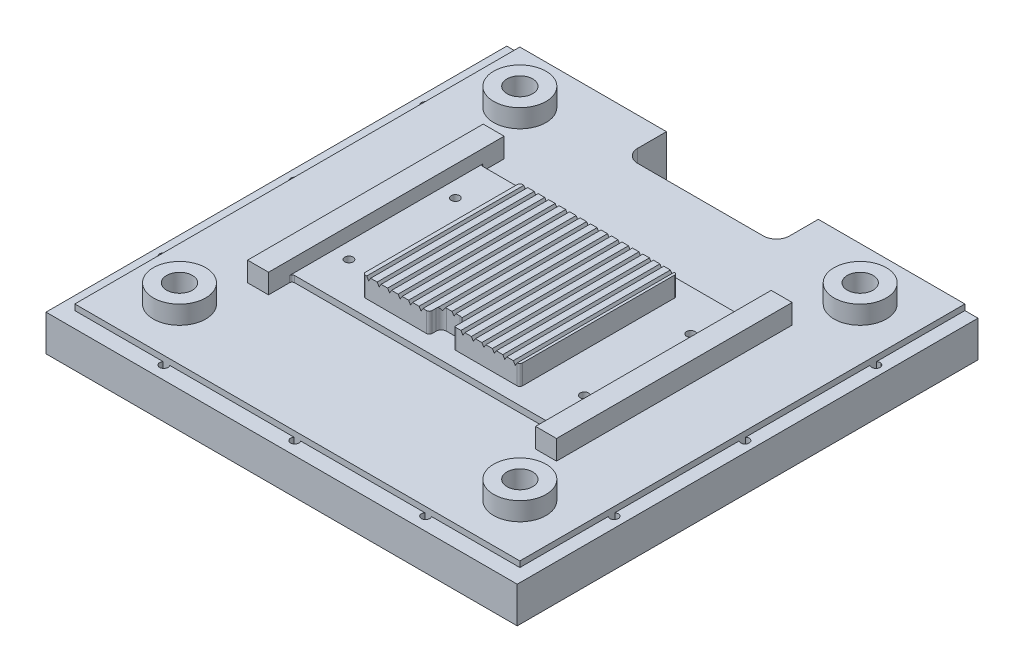
from build123d import *

# Parameters (mm, degrees)
BOSS_EXTRUDE1_OUTLINE_W              = 90
BOSS_EXTRUDE1_OUTLINE_H              = 88
BOSS_EXTRUDE1_DEPTH                  = 6.9
BOSS_EXTRUDE1_2_OUTLINE_R            = 3.969
BOSS_EXTRUDE1_2_DEPTH                = 8
BOSS_EXTRUDE1_START                  = 4.166
BOSS_EXTRUDE1_3_OUTLINE_R            = 5
BOSS_EXTRUDE1_3_OUTLINE_R_2          = 2.4575
BOSS_EXTRUDE1_3_DEPTH                = 7.334
BOSS_EXTRUDE1_START_2                = 11.5
BOSS_EXTRUDE1_4_DEPTH                = 0.88
BOSS_EXTRUDE1_START_3                = 12.38
BOSS_EXTRUDE1_5_DEPTH                = 0.62
BOSS_EXTRUDE1_START_4                = -15
BOSS_EXTRUDE1_6_DEPTH                = 30
SKETCH2_R                            = 3.969
CUT_EXTRUDE1_DEPTH                   = 4.166
SKETCH5_W                            = 51.5
SKETCH5_H                            = 8
CUT_EXTRUDE2_DEPTH                   = 10
FILLET1_R                            = 2.5
BOSS_EXTRUDE3_DEPTH                  = 2.3
SKETCH11_R                           = 2.15
CUT_EXTRUDE6_DEPTH                   = 65.36505263
SKETCH12_W                           = 4
SKETCH12_H                           = 45
BOSS_EXTRUDE4_DEPTH                  = 4.85
SKETCH16_W                           = 35
SKETCH16_H                           = 13
CUT_EXTRUDE9_DEPTH                   = 3
FILLET2_R                            = 1.5
SKETCH18_W                           = 0.8
SKETCH18_H                           = 9.2
TAP_DRILL_FOR_M2X0_4_TAP2_AT_2_COUNT = 2
TAP_DRILL_FOR_M2X0_4_TAP2_AT_2_PITCH = 20.32
MIRROR1_COPY_1_SKETCH_W              = 0.8
MIRROR1_COPY_1_SKETCH_H              = 9.2
SKETCH20_W                           = 0.8
SKETCH20_H                           = 6.9
TAP_DRILL_FOR_M2X0_4_TAP1_AT_2_COUNT = 2
TAP_DRILL_FOR_M2X0_4_TAP1_AT_2_PITCH = 25
TAP_DRILL_FOR_M2X0_4_TAP1_AT_3_COUNT = 2
TAP_DRILL_FOR_M2X0_4_TAP1_AT_3_PITCH = 50
TAP_DRILL_FOR_M2X0_4_TAP1_AT_4_COUNT = 2
TAP_DRILL_FOR_M2X0_4_TAP1_AT_4_PITCH = 70.34202158
TAP_DRILL_FOR_M2X0_4_TAP1_AT_5_COUNT = 2
TAP_DRILL_FOR_M2X0_4_TAP1_AT_5_PITCH = 80.454956342
TAP_DRILL_FOR_M2X0_4_TAP1_AT_6_COUNT = 2
TAP_DRILL_FOR_M2X0_4_TAP1_AT_6_PITCH = 96.166522241
TAP_DRILL_FOR_M2X0_4_TAP1_AT_7_COUNT = 2
TAP_DRILL_FOR_M2X0_4_TAP1_AT_7_PITCH = 99.478640924
TAP_DRILL_FOR_M2X0_4_TAP1_AT_8_COUNT = 2
TAP_DRILL_FOR_M2X0_4_TAP1_AT_8_PITCH = 89.56003573
TAP_DRILL_FOR_M2X0_4_TAP1_AT_9_COUNT = 2
TAP_DRILL_FOR_M2X0_4_TAP1_AT_9_PITCH = 86
FILLET3_R                            = 0.5


with BuildPart() as part:
    # Boss-Extrude1: read off the stored shape, not the designer's step
    # Boss-Extrude1 outline → Boss-Extrude1 (new body)
    with BuildSketch(Plane(origin=(0, 0, 0), x_dir=(1, 0, 0), z_dir=(0, 1, 0))):
        with Locations((0, -1.5)):
            Rectangle(BOSS_EXTRUDE1_OUTLINE_W, BOSS_EXTRUDE1_OUTLINE_H)
    extrude(amount=BOSS_EXTRUDE1_DEPTH)

    # Sketch2 → Cut-Extrude1 (cut)
    with BuildSketch(Plane.XZ):
        with Locations(Location((-27.5, 27.5, 0), (0, 0, 270))):
            Circle(SKETCH2_R)
        with Locations(Location((27.5, 27.5, 0), (0, 0, 90))):
            Circle(SKETCH2_R)
        with Locations(Location((27.5, -27.5, 0), (0, 0, 270))):
            Circle(SKETCH2_R)
        with Locations(Location((-27.5, -27.5, 0), (0, 0, 90))):
            Circle(SKETCH2_R)
    extrude(amount=-CUT_EXTRUDE1_DEPTH, mode=Mode.SUBTRACT)

    # Sketch5 → Cut-Extrude2 (cut)
    with BuildSketch(Plane(origin=(0, 6.9, 0), x_dir=(1, 0, 0), z_dir=(0, 1, 0))):
        with Locations((10.75, 38.5)):
            Rectangle(SKETCH5_W, SKETCH5_H)
    extrude(amount=-CUT_EXTRUDE2_DEPTH, mode=Mode.SUBTRACT)

    # Fillet1
    fillet1_edges = [part.edges().sort_by_distance(p)[0] for p in [
        (36.5, 3.45, -34.5),
        (-15, 3.45, -34.5),
    ]]
    fillet(fillet1_edges, radius=FILLET1_R)

    # Sketch4 → Boss-Extrude3 (add)
    with BuildSketch(Plane(origin=(0, 6.9, 0), x_dir=(1, 0, 0), z_dir=(0, 1, 0))):
        with BuildLine():
            Line((27, -18), (-27, -18))
            ThreePointArc((-27, -18), (-27.353553391, -17.853553391), (-27.5, -17.5))
            Line((-27.5, -17.5), (-27.5, 17.5))
            ThreePointArc((-27.5, 17.5), (-27.353553391, 17.853553391), (-27, 18))
            Line((-27, 18), (27, 18))
            ThreePointArc((27, 18), (27.353553391, 17.853553391), (27.5, 17.5))
            Line((27.5, 17.5), (27.5, -17.5))
            ThreePointArc((27.5, -17.5), (27.353553391, -17.853553391), (27, -18))
        make_face()
    extrude(amount=BOSS_EXTRUDE3_DEPTH)

    # Sketch11 → Cut-Extrude6 (cut, through all)
    with BuildSketch(Plane(origin=(0, 6.9, 0), x_dir=(1, 0, 0), z_dir=(0, 1, 0))):
        with Locations(Location((27.5, -27.5, 0), (0, 0, 270))):
            Circle(SKETCH11_R)
        with Locations(Location((-27.5, -27.5, 0), (0, 0, 270))):
            Circle(SKETCH11_R)
        with Locations(Location((-27.5, 27.5, 0), (0, 0, 270))):
            Circle(SKETCH11_R)
        with Locations(Location((27.5, 27.5, 0), (0, 0, 270))):
            Circle(SKETCH11_R)
    extrude(amount=-CUT_EXTRUDE6_DEPTH, mode=Mode.SUBTRACT)

    # Sketch12 → Boss-Extrude4 (add)
    with BuildSketch(Plane(origin=(0, 6.9, 0), x_dir=(1, 0, 0), z_dir=(0, 1, 0))):
        with Locations((27.5, 0)):
            Rectangle(SKETCH12_W, SKETCH12_H)
        with Locations((-27.5, 0)):
            Rectangle(SKETCH12_W, SKETCH12_H)
    extrude(amount=BOSS_EXTRUDE4_DEPTH)

    # Sketch16 → Cut-Extrude9 (cut)
    with BuildSketch(Plane(origin=(0, 6.9, 0), x_dir=(1, 0, 0), z_dir=(0, 1, 0))):
        with Locations((0, 24.5)):
            Rectangle(SKETCH16_W, SKETCH16_H)
        with Locations((0, -24.5)):
            Rectangle(SKETCH16_W, SKETCH16_H)
    extrude(amount=-CUT_EXTRUDE9_DEPTH, mode=Mode.SUBTRACT)

    # Fillet2
    fillet2_edges = [part.edges().sort_by_distance(p)[0] for p in [
        (17.5, 5.4, -31),
        (17.5, 5.4, -18),
        (-17.5, 5.4, -18),
        (-17.5, 5.4, -31),
        (-17.5, 5.4, 31),
        (-17.5, 5.4, 18),
        (17.5, 5.4, 18),
        (17.5, 5.4, 31),
    ]]
    fillet(fillet2_edges, radius=FILLET2_R)

    # Sketch18 → Tap Drill for M2x0.4 Tap2 (revolve, cut)
    with BuildSketch(Plane(origin=(22.48, 9.2, 10.16), x_dir=(0, 0, 1), z_dir=(1, 0, 0))):
        with Locations((0.4, 4.6)):
            Rectangle(SKETCH18_W, SKETCH18_H)
    tap_drill_for_m2x0_4_tap2 = revolve(axis=Axis((22.48, 15.55, 10.16), (0, -1, 0)), mode=Mode.SUBTRACT)

    # Tap Drill for M2x0.4 Tap2 at 2: Tap Drill for M2x0.4 Tap2 ×2
    with Locations(*[(0, 0, -i * TAP_DRILL_FOR_M2X0_4_TAP2_AT_2_PITCH) for i in range(1, TAP_DRILL_FOR_M2X0_4_TAP2_AT_2_COUNT)]):
        add(tap_drill_for_m2x0_4_tap2, mode=Mode.SUBTRACT)

    # Mirror1: Tap Drill for M2x0.4 Tap2 across plane
    add(tap_drill_for_m2x0_4_tap2.mirror(Plane(origin=(0, 0, 0), x_dir=(0, 0, 1), z_dir=(1, 0, 0))), mode=Mode.SUBTRACT)

    # Mirror1 copy 1 sketch → Mirror1 copy 1 (revolve, cut)
    with BuildSketch(Plane(origin=(-22.48, 9.2, -10.16), x_dir=(0, 0, 1), z_dir=(-1, 0, 0))):
        with Locations((0.4, -4.6)):
            Rectangle(MIRROR1_COPY_1_SKETCH_W, MIRROR1_COPY_1_SKETCH_H)
    revolve(axis=Axis((-22.48, 15.55, -10.16), (0, 1, 0)), mode=Mode.SUBTRACT)

    # Sketch20 → Tap Drill for M2x0.4 Tap1 (revolve, cut)
    with BuildSketch(Plane(origin=(-43, 6.9, -25), x_dir=(0, 0, 1), z_dir=(1, 0, 0))):
        with Locations((0.4, 3.45)):
            Rectangle(SKETCH20_W, SKETCH20_H)
    tap_drill_for_m2x0_4_tap1 = revolve(axis=Axis((-43, 13.25, -25), (0, -1, 0)), mode=Mode.SUBTRACT)

    # Tap Drill for M2x0.4 Tap1 at 2: Tap Drill for M2x0.4 Tap1 ×2
    with Locations(*[(0, 0, i * TAP_DRILL_FOR_M2X0_4_TAP1_AT_2_PITCH) for i in range(1, TAP_DRILL_FOR_M2X0_4_TAP1_AT_2_COUNT)]):
        add(tap_drill_for_m2x0_4_tap1, mode=Mode.SUBTRACT)

    # Tap Drill for M2x0.4 Tap1 at 3: Tap Drill for M2x0.4 Tap1 ×2
    with Locations(*[(0, 0, i * TAP_DRILL_FOR_M2X0_4_TAP1_AT_3_PITCH) for i in range(1, TAP_DRILL_FOR_M2X0_4_TAP1_AT_3_COUNT)]):
        add(tap_drill_for_m2x0_4_tap1, mode=Mode.SUBTRACT)

    # Tap Drill for M2x0.4 Tap1 at 4: Tap Drill for M2x0.4 Tap1 ×2
    with Locations(*[Vector(0.25589256031628077, 0, 0.9667052278615125) * (i * TAP_DRILL_FOR_M2X0_4_TAP1_AT_4_PITCH) for i in range(1, TAP_DRILL_FOR_M2X0_4_TAP1_AT_4_COUNT)]):
        add(tap_drill_for_m2x0_4_tap1, mode=Mode.SUBTRACT)

    # Tap Drill for M2x0.4 Tap1 at 5: Tap Drill for M2x0.4 Tap1 ×2
    with Locations(*[Vector(0.5344605473053958, 0, 0.8451934236457456) * (i * TAP_DRILL_FOR_M2X0_4_TAP1_AT_5_PITCH) for i in range(1, TAP_DRILL_FOR_M2X0_4_TAP1_AT_5_COUNT)]):
        add(tap_drill_for_m2x0_4_tap1, mode=Mode.SUBTRACT)

    # Tap Drill for M2x0.4 Tap1 at 6: Tap Drill for M2x0.4 Tap1 ×2
    with Locations(*[Vector(0.7071067811865462, 0, 0.7071067811865488) * (i * TAP_DRILL_FOR_M2X0_4_TAP1_AT_6_PITCH) for i in range(1, TAP_DRILL_FOR_M2X0_4_TAP1_AT_6_COUNT)]):
        add(tap_drill_for_m2x0_4_tap1, mode=Mode.SUBTRACT)

    # Tap Drill for M2x0.4 Tap1 at 7: Tap Drill for M2x0.4 Tap1 ×2
    with Locations(*[Vector(0.8645071866841927, 0, 0.5026204573745308) * (i * TAP_DRILL_FOR_M2X0_4_TAP1_AT_7_PITCH) for i in range(1, TAP_DRILL_FOR_M2X0_4_TAP1_AT_7_COUNT)]):
        add(tap_drill_for_m2x0_4_tap1, mode=Mode.SUBTRACT)

    # Tap Drill for M2x0.4 Tap1 at 8: Tap Drill for M2x0.4 Tap1 ×2
    with Locations(*[Vector(0.9602497285624915, 0, 0.27914236295421274) * (i * TAP_DRILL_FOR_M2X0_4_TAP1_AT_8_PITCH) for i in range(1, TAP_DRILL_FOR_M2X0_4_TAP1_AT_8_COUNT)]):
        add(tap_drill_for_m2x0_4_tap1, mode=Mode.SUBTRACT)

    # Tap Drill for M2x0.4 Tap1 at 9: Tap Drill for M2x0.4 Tap1 ×2
    with Locations(*[(i * TAP_DRILL_FOR_M2X0_4_TAP1_AT_9_PITCH, 0, 0) for i in range(1, TAP_DRILL_FOR_M2X0_4_TAP1_AT_9_COUNT)]):
        add(tap_drill_for_m2x0_4_tap1, mode=Mode.SUBTRACT)

    # Fillet3
    fillet3_edges = [part.edges().sort_by_distance(p)[0] for p in [
        (-25.5, 8.05, 18),
        (-25.5, 8.05, -18),
        (25.5, 8.05, 18),
        (25.5, 8.05, -18),
    ]]
    fillet(fillet3_edges, radius=FILLET3_R)


with BuildPart() as body_2:
    # Boss-Extrude1 2 outline → Boss-Extrude1 2 (new body)
    with BuildSketch(Plane(origin=(0, 0, 0), x_dir=(1, 0, 0), z_dir=(0, 1, 0))):
        with BuildLine():
            Line((42.5, 42.5), (14.5, 42.5))
            Line((14.5, 42.5), (14.5, 37))
            ThreePointArc((14.5, 37), (13.767766953, 35.232233047), (12, 34.5))
            Line((12, 34.5), (-12, 34.5))
            ThreePointArc((-12, 34.5), (-13.767766953, 35.232233047), (-14.5, 37))
            Line((-14.5, 37), (-14.5, 42.5))
            Line((-14.5, 42.5), (-42.5, 42.5))
            Line((-42.5, 42.5), (-42.5, -42.5))
            Line((-42.5, -42.5), (42.5, -42.5))
            Line((42.5, -42.5), (42.5, 42.5))
        make_face()
        with Locations((-32.5, -32.5)):
            Circle(BOSS_EXTRUDE1_2_OUTLINE_R, mode=Mode.SUBTRACT)
        with Locations((32.5, -32.5)):
            Circle(BOSS_EXTRUDE1_2_OUTLINE_R, mode=Mode.SUBTRACT)
        with Locations((-32.5, 32.5)):
            Circle(BOSS_EXTRUDE1_2_OUTLINE_R, mode=Mode.SUBTRACT)
        with Locations((32.5, 32.5)):
            Circle(BOSS_EXTRUDE1_2_OUTLINE_R, mode=Mode.SUBTRACT)
    extrude(amount=BOSS_EXTRUDE1_2_DEPTH)

    # Boss-Extrude1 3 outline → Boss-Extrude1 3 (add)
    # profile 1 of 5: a face of its own
    with BuildSketch(Plane(origin=(0, 0, 0), x_dir=(1, 0, 0), z_dir=(0, 1, 0)).offset(BOSS_EXTRUDE1_START)):
        with Locations((32.5, 32.5)):
            Circle(BOSS_EXTRUDE1_3_OUTLINE_R)
        with Locations((32.5, 32.5)):
            Circle(BOSS_EXTRUDE1_3_OUTLINE_R_2, mode=Mode.SUBTRACT)
    # profile 2 of 5: a face of its own
    with BuildSketch(Plane(origin=(0, 0, 0), x_dir=(1, 0, 0), z_dir=(0, 1, 0)).offset(BOSS_EXTRUDE1_START)):
        with Locations((32.5, -32.5)):
            Circle(BOSS_EXTRUDE1_3_OUTLINE_R)
        with Locations((32.5, -32.5)):
            Circle(BOSS_EXTRUDE1_3_OUTLINE_R_2, mode=Mode.SUBTRACT)
    # profile 3 of 5: a face of its own
    with BuildSketch(Plane(origin=(0, 0, 0), x_dir=(1, 0, 0), z_dir=(0, 1, 0)).offset(BOSS_EXTRUDE1_START)):
        with Locations((-32.5, -32.5)):
            Circle(BOSS_EXTRUDE1_3_OUTLINE_R)
        with Locations((-32.5, -32.5)):
            Circle(BOSS_EXTRUDE1_3_OUTLINE_R_2, mode=Mode.SUBTRACT)
    # profile 4 of 5: a face of its own
    with BuildSketch(Plane(origin=(0, 0, 0), x_dir=(1, 0, 0), z_dir=(0, 1, 0)).offset(BOSS_EXTRUDE1_START)):
        with Locations((-32.5, 32.5)):
            Circle(BOSS_EXTRUDE1_3_OUTLINE_R)
        with Locations((-32.5, 32.5)):
            Circle(BOSS_EXTRUDE1_3_OUTLINE_R_2, mode=Mode.SUBTRACT)
    # profile 5 of 5: a face of its own
    with BuildSketch(Plane(origin=(0, 0, 0), x_dir=(1, 0, 0), z_dir=(0, 1, 0)).offset(BOSS_EXTRUDE1_START)):
        with BuildLine():
            ThreePointArc((-14.5, 15), (-14.853553391, 14.853553391), (-15, 14.5))
            Line((-15, 14.5), (-15, -14.5))
            ThreePointArc((-15, -14.5), (-14.853553391, -14.853553391), (-14.5, -15))
            Line((-14.5, -15), (-2.7929, -15))
            ThreePointArc((-2.7929, -15), (-2.439346609, -14.853553391), (-2.2929, -14.5))
            Line((-2.2929, -14.5), (-2.2929, -13.7071))
            ThreePointArc((-2.2929, -13.7071), (-2.000006781, -12.999993219), (-1.2929, -12.7071))
            Line((-1.2929, -12.7071), (1.2929, -12.7071))
            ThreePointArc((1.2929, -12.7071), (2.000006781, -12.999993219), (2.2929, -13.7071))
            Line((2.2929, -13.7071), (2.2929, -14.5))
            ThreePointArc((2.2929, -14.5), (2.439346609, -14.853553391), (2.7929, -15))
            Line((2.7929, -15), (14.5, -15))
            ThreePointArc((14.5, -15), (14.853553391, -14.853553391), (15, -14.5))
            Line((15, -14.5), (15, 14.5))
            ThreePointArc((15, 14.5), (14.853553391, 14.853553391), (14.5, 15))
            Line((14.5, 15), (-14.5, 15))
        make_face()
    extrude(amount=BOSS_EXTRUDE1_3_DEPTH)

    # Boss-Extrude1 4 outline → Boss-Extrude1 4 (add)
    with BuildSketch(Plane(origin=(0, 0, 0), x_dir=(1, 0, 0), z_dir=(0, 1, 0)).offset(BOSS_EXTRUDE1_START_2)):
        with BuildLine():
            ThreePointArc((-14.5, 15), (-14.853553391, 14.853553391), (-15, 14.5))
            Line((-15, 14.5), (-15, -14.5))
            ThreePointArc((-15, -14.5), (-14.853553391, -14.853553391), (-14.5, -15))
            Line((-14.5, -15), (-2.7929, -15))
            ThreePointArc((-2.7929, -15), (-2.439346609, -14.853553391), (-2.2929, -14.5))
            Line((-2.2929, -14.5), (-2.2929, -13.7071))
            ThreePointArc((-2.2929, -13.7071), (-2.000006781, -12.999993219), (-1.2929, -12.7071))
            Line((-1.2929, -12.7071), (1.2929, -12.7071))
            ThreePointArc((1.2929, -12.7071), (2.000006781, -12.999993219), (2.2929, -13.7071))
            Line((2.2929, -13.7071), (2.2929, -14.5))
            ThreePointArc((2.2929, -14.5), (2.439346609, -14.853553391), (2.7929, -15))
            Line((2.7929, -15), (14.5, -15))
            ThreePointArc((14.5, -15), (14.853553391, -14.853553391), (15, -14.5))
            Line((15, -14.5), (15, 14.5))
            ThreePointArc((15, 14.5), (14.853553391, 14.853553391), (14.5, 15))
            Line((14.5, 15), (-14.5, 15))
        make_face()
    extrude(amount=BOSS_EXTRUDE1_4_DEPTH)

    # Boss-Extrude1 5 outline → Boss-Extrude1 5 (add)
    with BuildSketch(Plane(origin=(0, 0, 0), x_dir=(1, 0, 0), z_dir=(0, 1, 0)).offset(BOSS_EXTRUDE1_START_3)):
        with BuildLine():
            ThreePointArc((-14.5, 15), (-14.853553391, 14.853553391), (-15, 14.5))
            Line((-15, 14.5), (-15, -14.5))
            ThreePointArc((-15, -14.5), (-14.853553391, -14.853553391), (-14.5, -15))
            Line((-14.5, -15), (-2.7929, -15))
            ThreePointArc((-2.7929, -15), (-2.439346609, -14.853553391), (-2.2929, -14.5))
            Line((-2.2929, -14.5), (-2.2929, -13.7071))
            ThreePointArc((-2.2929, -13.7071), (-2.000006781, -12.999993219), (-1.2929, -12.7071))
            Line((-1.2929, -12.7071), (1.2929, -12.7071))
            ThreePointArc((1.2929, -12.7071), (2.000006781, -12.999993219), (2.2929, -13.7071))
            Line((2.2929, -13.7071), (2.2929, -14.5))
            ThreePointArc((2.2929, -14.5), (2.439346609, -14.853553391), (2.7929, -15))
            Line((2.7929, -15), (14.5, -15))
            ThreePointArc((14.5, -15), (14.853553391, -14.853553391), (15, -14.5))
            Line((15, -14.5), (15, 14.5))
            ThreePointArc((15, 14.5), (14.853553391, 14.853553391), (14.5, 15))
            Line((14.5, 15), (-14.5, 15))
        make_face()
    extrude(amount=BOSS_EXTRUDE1_5_DEPTH)

    # Boss-Extrude1 6 outline → Boss-Extrude1 6 (cut)
    with BuildSketch(Plane.XY.offset(BOSS_EXTRUDE1_START_4)):
        Polygon((-13.5, 13), (-14.25, 13), (-13.875, 12.38), align=None)
        Polygon((14.5, 13), (13.75, 13), (14.125, 12.38), align=None)
        Polygon((12.5, 13), (11.75, 13), (12.125, 12.38), align=None)
        Polygon((10.5, 13), (9.75, 13), (10.125, 12.38), align=None)
        Polygon((8.5, 13), (7.75, 13), (8.125, 12.38), align=None)
        Polygon((6.5, 13), (5.75, 13), (6.125, 12.38), align=None)
        Polygon((4.5, 13), (3.75, 13), (4.125, 12.38), align=None)
        Polygon((2.5, 13), (1.75, 13), (2.125, 12.38), align=None)
        Polygon((0.5, 13), (-0.25, 13), (0.125, 12.38), align=None)
        Polygon((-1.5, 13), (-2.25, 13), (-1.875, 12.38), align=None)
        Polygon((-3.5, 13), (-4.25, 13), (-3.875, 12.38), align=None)
        Polygon((-5.5, 13), (-6.25, 13), (-5.875, 12.38), align=None)
        Polygon((-7.5, 13), (-8.25, 13), (-7.875, 12.38), align=None)
        Polygon((-9.5, 13), (-10.25, 13), (-9.875, 12.38), align=None)
        Polygon((-11.5, 13), (-12.25, 13), (-11.875, 12.38), align=None)
    extrude(amount=BOSS_EXTRUDE1_6_DEPTH, mode=Mode.SUBTRACT)


solid = Compound([part.part, body_2.part])
